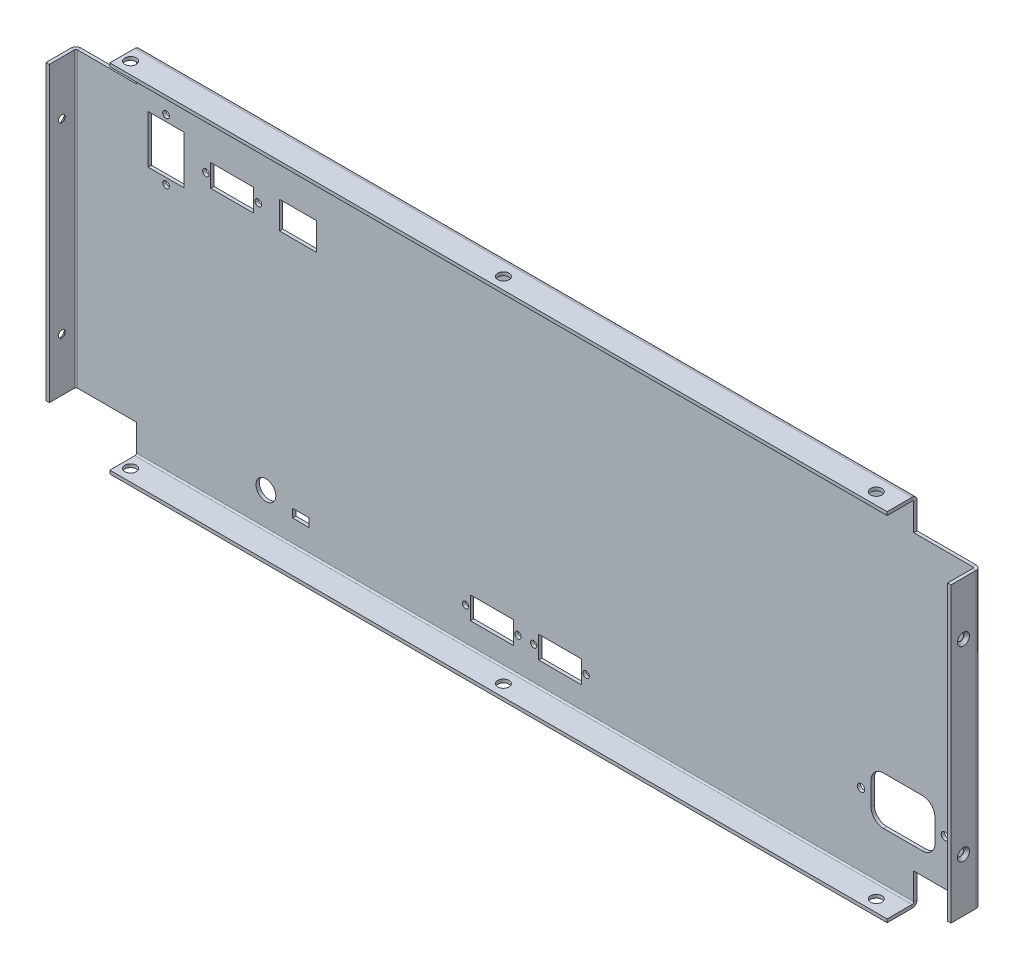
from build123d import *

# Parameters (mm, degrees)
BASE_FLANGE_DEPTH               = 1.5875
EDGE_FLANGE1_STRIP_W            = 7.8232
EDGE_FLANGE1_STRIP_H            = 1.5875
EDGE_FLANGE1_STRIP_CUT_DEPTH    = 139.7
EDGE_FLANGE1_DEPTH              = 139.7
EDGE_FLANGE2_STRIP_W            = 7.8232
EDGE_FLANGE2_STRIP_H            = 1.5875
EDGE_FLANGE2_STRIP_CUT_DEPTH    = 139.7
EDGE_FLANGE2_DEPTH              = 139.7
EDGE_FLANGE3_STRIP_W            = 7.8232
EDGE_FLANGE3_STRIP_H            = 1.5875
EDGE_FLANGE3_STRIP_CUT_DEPTH    = 370.68125
EDGE_FLANGE3_DEPTH              = 370.68125
EDGE_FLANGE4_STRIP_W            = 7.8232
EDGE_FLANGE4_STRIP_H            = 1.5875
EDGE_FLANGE4_STRIP_CUT_DEPTH    = 370.68125
EDGE_FLANGE4_DEPTH              = 370.68125
SKETCH15_W                      = 20.4724
SKETCH15_H                      = 10.668
CUT_EXTRUDE1_DEPTH              = 458.107468491
SKETCH16_W                      = 17.653
SKETCH16_H                      = 13.081
CUT_EXTRUDE2_DEPTH              = 458.107468491
F_1_8_0_125_DIAMETER_HOLE1_D    = 3.175
LPATTERN2_COUNT                 = 2
LPATTERN2_PITCH                 = 24.9936
SKETCH20_W                      = 17.145
SKETCH20_H                      = 22.987
CUT_EXTRUDE4_DEPTH              = 458.107468491
F_40_0_098_DIAMETER_HOLE2_D     = 3.175
SKETCH31_W                      = 30.48
SKETCH31_H                      = 22.86
CUT_EXTRUDE5_DEPTH              = 458.107468491
F_40_0_098_DIAMETER_HOLE3_D     = 3.556
F_40_0_098_DIAMETER_HOLE4_D     = 3.556
F_40_0_098_DIAMETER_HOLE4_DEPTH = 1.5875
F_40_0_098_DIAMETER_HOLE4_TIP   = 1.068330181
FILLET1_R                       = 5.9436
SKETCH38_W                      = 20.4724
SKETCH38_H                      = 10.668
CUT_EXTRUDE6_DEPTH              = 2.54
LPATTERN3_COUNT                 = 2
LPATTERN3_PITCH                 = 32.4866
LPATTERN4_COUNT                 = 2
LPATTERN4_PITCH                 = 24.9936
LPATTERN5_COUNT                 = 2
LPATTERN5_PITCH                 = 32.4866
LPATTERN7_COUNT                 = 2
LPATTERN7_PITCH                 = 57.4802
LPATTERN8_COUNT                 = 2
LPATTERN8_PITCH                 = 88.9
SKETCH41_R                      = 4.7117
CUT_EXTRUDE7_DEPTH              = 2.54
SKETCH43_W                      = 7.7978
SKETCH43_H                      = 4.0132
CUT_EXTRUDE8_DEPTH              = 2.54
HOLE1_START                     = -15.0368
HOLE1_OUTLINE_R                 = 2.7051
HOLE1_DEPTH                     = 169.7736
LPATTERN9_COUNT                 = 3
LPATTERN9_PITCH                 = 177.8


# Read off the part's stored shape, not the designer's step: Hole1
# Sheet-metal steps are written as plain solids
with BuildPart() as part:
    # Sketch1 → Base-Flange (new body)
    with BuildSketch(Plane.XY):
        Polygon((0, 0), (28.832175, 0), (28.832175, -13.4493), (399.513425, -13.4493), (399.513425, 0), (428.3456, 0), (428.3456, 139.7), (399.513425, 139.7), (399.513425, 153.1493), (28.832175, 153.1493), (28.832175, 139.7), (0, 139.7), align=None)
    extrude(amount=BASE_FLANGE_DEPTH)

    # Edge-Flange1 strip (across the edge) → Edge-Flange1 strip cut (cut)
    with BuildSketch(Plane(origin=(428.3456, 0, 1.5875), x_dir=(-1, 0, 0), z_dir=(0, 1, 0))):
        with Locations((-3.175, -0.79375)):
            Rectangle(EDGE_FLANGE1_STRIP_W, EDGE_FLANGE1_STRIP_H)
    extrude(amount=EDGE_FLANGE1_STRIP_CUT_DEPTH, mode=Mode.SUBTRACT)

    # Edge-Flange1 section (across the edge) → Edge-Flange1 (add)
    with BuildSketch(Plane(origin=(428.3456, 0, 1.5875), x_dir=(-1, 0, 0), z_dir=(0, 1, 0))):
        with BuildLine():
            Line((-1.5875, 0.7366), (-1.5875, 12.7))
            Line((-1.5875, 12.7), (0, 12.7))
            Line((0, 12.7), (0, 0.7366))
            ThreePointArc((0, 0.7366), (0.215745145, 0.215745145), (0.7366, 0))
            Line((0.7366, 0), (0.7366, -1.5875))
            ThreePointArc((0.7366, -1.5875), (-0.90678687, -0.90678687), (-1.5875, 0.7366))
        make_face()
    extrude(amount=EDGE_FLANGE1_DEPTH)

    # Edge-Flange2 strip (across the edge) → Edge-Flange2 strip cut (cut)
    with BuildSketch(Plane(origin=(0, 139.7, 1.5875), x_dir=(1, 0, 0), z_dir=(0, -1, 0))):
        with Locations((-3.175, -0.79375)):
            Rectangle(EDGE_FLANGE2_STRIP_W, EDGE_FLANGE2_STRIP_H)
    extrude(amount=EDGE_FLANGE2_STRIP_CUT_DEPTH, mode=Mode.SUBTRACT)

    # Edge-Flange2 section (across the edge) → Edge-Flange2 (add)
    with BuildSketch(Plane(origin=(0, 139.7, 1.5875), x_dir=(1, 0, 0), z_dir=(0, -1, 0))):
        with BuildLine():
            Line((-1.5875, 0.7366), (-1.5875, 12.7))
            Line((-1.5875, 12.7), (0, 12.7))
            Line((0, 12.7), (0, 0.7366))
            ThreePointArc((0, 0.7366), (0.215745145, 0.215745145), (0.7366, 0))
            Line((0.7366, 0), (0.7366, -1.5875))
            ThreePointArc((0.7366, -1.5875), (-0.90678687, -0.90678687), (-1.5875, 0.7366))
        make_face()
    extrude(amount=EDGE_FLANGE2_DEPTH)

    # Edge-Flange3 strip (across the edge) → Edge-Flange3 strip cut (cut)
    with BuildSketch(Plane(origin=(399.513425, 153.1493, 1.5875), x_dir=(0, -1, 0), z_dir=(-1, 0, 0))):
        with Locations((-3.175, -0.79375)):
            Rectangle(EDGE_FLANGE3_STRIP_W, EDGE_FLANGE3_STRIP_H)
    extrude(amount=EDGE_FLANGE3_STRIP_CUT_DEPTH, mode=Mode.SUBTRACT)

    # Edge-Flange3 section (across the edge) → Edge-Flange3 (add)
    with BuildSketch(Plane(origin=(399.513425, 153.1493, 1.5875), x_dir=(0, -1, 0), z_dir=(-1, 0, 0))):
        with BuildLine():
            Line((-1.5875, 0.7366), (-1.5875, 12.7))
            Line((-1.5875, 12.7), (0, 12.7))
            Line((0, 12.7), (0, 0.7366))
            ThreePointArc((0, 0.7366), (0.215745145, 0.215745145), (0.7366, 0))
            Line((0.7366, 0), (0.7366, -1.5875))
            ThreePointArc((0.7366, -1.5875), (-0.90678687, -0.90678687), (-1.5875, 0.7366))
        make_face()
    extrude(amount=EDGE_FLANGE3_DEPTH)

    # Edge-Flange4 strip (across the edge) → Edge-Flange4 strip cut (cut)
    with BuildSketch(Plane(origin=(28.832175, -13.4493, 1.5875), x_dir=(0, 1, 0), z_dir=(1, 0, 0))):
        with Locations((-3.175, -0.79375)):
            Rectangle(EDGE_FLANGE4_STRIP_W, EDGE_FLANGE4_STRIP_H)
    extrude(amount=EDGE_FLANGE4_STRIP_CUT_DEPTH, mode=Mode.SUBTRACT)

    # Edge-Flange4 section (across the edge) → Edge-Flange4 (add)
    with BuildSketch(Plane(origin=(28.832175, -13.4493, 1.5875), x_dir=(0, 1, 0), z_dir=(1, 0, 0))):
        with BuildLine():
            Line((-1.5875, 0.7366), (-1.5875, 12.7))
            Line((-1.5875, 12.7), (0, 12.7))
            Line((0, 12.7), (0, 0.7366))
            ThreePointArc((0, 0.7366), (0.215745145, 0.215745145), (0.7366, 0))
            Line((0.7366, 0), (0.7366, -1.5875))
            ThreePointArc((0.7366, -1.5875), (-0.90678687, -0.90678687), (-1.5875, 0.7366))
        make_face()
    extrude(amount=EDGE_FLANGE4_DEPTH)

    # Sketch15 → Cut-Extrude1 (cut, through all)
    with BuildSketch(Plane.XY.offset(1.5875)):
        with Locations((74.4728, 119.6213)):
            Rectangle(SKETCH15_W, SKETCH15_H)
    extrude(amount=-CUT_EXTRUDE1_DEPTH, mode=Mode.SUBTRACT)

    # Sketch16 → Cut-Extrude2 (cut, through all)
    with BuildSketch(Plane.XY.offset(1.5875)):
        with Locations((105.8291, 119.6213)):
            Rectangle(SKETCH16_W, SKETCH16_H)
    extrude(amount=-CUT_EXTRUDE2_DEPTH, mode=Mode.SUBTRACT)

    # 1/8 (0.125) Diameter Hole1 (through all)
    with Locations(Plane.XY.offset(1.5875)):
        with Locations((61.976, 119.6213)):
            f_1_8_0_125_diameter_hole1 = Hole(F_1_8_0_125_DIAMETER_HOLE1_D / 2)

    # LPattern2: 1/8 (0.125) Diameter Hole1 ×2
    with Locations(*[(i * LPATTERN2_PITCH, 0, 0) for i in range(1, LPATTERN2_COUNT)]):
        add(f_1_8_0_125_diameter_hole1, mode=Mode.SUBTRACT)

    # Sketch20 → Cut-Extrude4 (cut, through all)
    with BuildSketch(Plane.XY.offset(1.5875)):
        with Locations((42.9641, 119.6213)):
            Rectangle(SKETCH20_W, SKETCH20_H)
    extrude(amount=-CUT_EXTRUDE4_DEPTH, mode=Mode.SUBTRACT)

    # #40 (0.098) Diameter Hole2 (through all)
    with Locations(Plane.XY.offset(1.5875)):
        with Locations((42.9641, 134.1247), (42.9641, 105.1179)):
            Hole(F_40_0_098_DIAMETER_HOLE2_D / 2)

    # Sketch31 → Cut-Extrude5 (cut, through all)
    with BuildSketch(Plane.XY.offset(1.5875)):
        with Locations((394.3731, 21.7932)):
            Rectangle(SKETCH31_W, SKETCH31_H)
    extrude(amount=-CUT_EXTRUDE5_DEPTH, mode=Mode.SUBTRACT)

    # #40 (0.098) Diameter Hole3 (through all)
    with Locations(Plane(origin=(374.3706, 21.7932, 1.5875), x_dir=(1, 0, 0), z_dir=(0, 0, 1))):
        with Locations((0, 0)):
            Hole(F_40_0_098_DIAMETER_HOLE3_D / 2)

    # #40 (0.098) Diameter Hole4
    with Locations(Plane.XY.offset(1.5875)):
        with Locations((414.3756, 21.7932)):
            Hole(F_40_0_098_DIAMETER_HOLE4_D / 2, depth=F_40_0_098_DIAMETER_HOLE4_DEPTH)
            with Locations((0, 0, -(F_40_0_098_DIAMETER_HOLE4_DEPTH + F_40_0_098_DIAMETER_HOLE4_TIP / 2))):  # 118° drill point
                Cone(0, F_40_0_098_DIAMETER_HOLE4_D / 2, F_40_0_098_DIAMETER_HOLE4_TIP, mode=Mode.SUBTRACT)

    # Fillet1
    fillet1_edges = [part.edges().sort_by_distance(p)[0] for p in [
        (379.1331, 10.3632, 0.79375),
        (379.1331, 33.2232, 0.79375),
        (409.6131, 33.2232, 0.79375),
        (409.6131, 10.3632, 0.79375),
    ]]
    fillet(fillet1_edges, radius=FILLET1_R)

    # Sketch38 → Cut-Extrude6 (cut)
    with BuildSketch(Plane(origin=(0, 0, 0), x_dir=(-1, 0, 0), z_dir=(0, 0, -1))):
        with Locations((-230.779365766, 2.9972)):
            Rectangle(SKETCH38_W, SKETCH38_H)
    cut_extrude6 = extrude(amount=-CUT_EXTRUDE6_DEPTH, mode=Mode.SUBTRACT)

    # LPattern3: Cut-Extrude6 ×2
    with Locations(*[(-i * LPATTERN3_PITCH, 0, 0) for i in range(1, LPATTERN3_COUNT)]):
        add(cut_extrude6, mode=Mode.SUBTRACT)

    # Sketch39 → #40 (0.098) Diameter Hole5 (revolve, cut)
    with BuildSketch(Plane(origin=(243.276165766, 2.9972, 0), x_dir=(0, 1, 0), z_dir=(1, 0, 0))):
        Polygon((0, 0), (0, 4.090711583), (1.524, 3.175), (1.524, 0), align=None)
    f_40_0_098_diameter_hole5 = revolve(axis=Axis((243.276165766, 2.9972, -6.35), (0, 0, 1)), mode=Mode.SUBTRACT)

    # LPattern4: #40 (0.098) Diameter Hole5 ×2
    with Locations(*[(-i * LPATTERN4_PITCH, 0, 0) for i in range(1, LPATTERN4_COUNT)]):
        add(f_40_0_098_diameter_hole5, mode=Mode.SUBTRACT)

    # LPattern5: #40 (0.098) Diameter Hole5 ×2
    with Locations(*[(-i * LPATTERN5_PITCH, 0, 0) for i in range(1, LPATTERN5_COUNT)]):
        add(f_40_0_098_diameter_hole5, mode=Mode.SUBTRACT)

    # LPattern7: #40 (0.098) Diameter Hole5 ×2
    with Locations(*[(-i * LPATTERN7_PITCH, 0, 0) for i in range(1, LPATTERN7_COUNT)]):
        add(f_40_0_098_diameter_hole5, mode=Mode.SUBTRACT)

    # Sketch42 → CSK for #4 Flat Head Machine Screw1 (revolve, cut)
    with BuildSketch(Plane(origin=(429.9331, 114.3, 8.3058), x_dir=(0, 0, -1), z_dir=(0, 1, 0))):
        Polygon((0, 0), (0, 1.5885), (1.63195, 1.5885), (1.63195, 1.409834001), (2.8575, 0), align=None)
    csk_for_4_flat_head_machine_screw1 = revolve(axis=Axis((436.2831, 114.3, 8.3058), (-1, 0, 0)), mode=Mode.SUBTRACT)

    # LPattern8: CSK for #4 Flat Head Machine Screw1 ×2
    with Locations(*[(0, -i * LPATTERN8_PITCH, 0) for i in range(1, LPATTERN8_COUNT)]):
        add(csk_for_4_flat_head_machine_screw1, mode=Mode.SUBTRACT)

    # Mirror1: CSK for #4 Flat Head Machine Screw1 across plane
    add(csk_for_4_flat_head_machine_screw1.mirror(Plane.ZY.offset(-214.1728)), mode=Mode.SUBTRACT)

    # Mirror1 copy 1 sketch → Mirror1 copy 1 (revolve, cut)
    with BuildSketch(Plane(origin=(-1.5875, 25.4, 8.3058), x_dir=(0, 0, -1), z_dir=(0, 1, 0))):
        Polygon((0, 0), (0, -1.5885), (1.63195, -1.5885), (1.63195, -1.409834001), (2.8575, 0), align=None)
    revolve(axis=Axis((-7.9375, 25.4, 8.3058), (-1, 0, 0)), mode=Mode.SUBTRACT)

    # Sketch41 → Cut-Extrude7 (cut)
    with BuildSketch(Plane(origin=(0, 0, 0), x_dir=(-1, 0, 0), z_dir=(0, 0, -1))):
        with Locations((-90.588465, 2.813286828)):
            Circle(SKETCH41_R)
    extrude(amount=-CUT_EXTRUDE7_DEPTH, mode=Mode.SUBTRACT)

    # Sketch43 → Cut-Extrude8 (cut)
    with BuildSketch(Plane.XY.offset(1.5875)):
        with Locations((107.187365, -0.331233172)):
            Rectangle(SKETCH43_W, SKETCH43_H)
    extrude(amount=-CUT_EXTRUDE8_DEPTH, mode=Mode.SUBTRACT)

    # Hole1 outline → Hole1 (cut)
    with BuildSketch(Plane(origin=(0, 0, 0), x_dir=(1, 0, 0), z_dir=(0, 1, 0)).offset(HOLE1_START)):
        with Locations((33.0835, -8.6233)):
            Circle(HOLE1_OUTLINE_R)
    hole1 = extrude(amount=HOLE1_DEPTH, mode=Mode.SUBTRACT)

    # LPattern9: Hole1 ×3
    with Locations(*[(i * LPATTERN9_PITCH, 0, 0) for i in range(1, LPATTERN9_COUNT)]):
        add(hole1, mode=Mode.SUBTRACT)


solid = part.part
